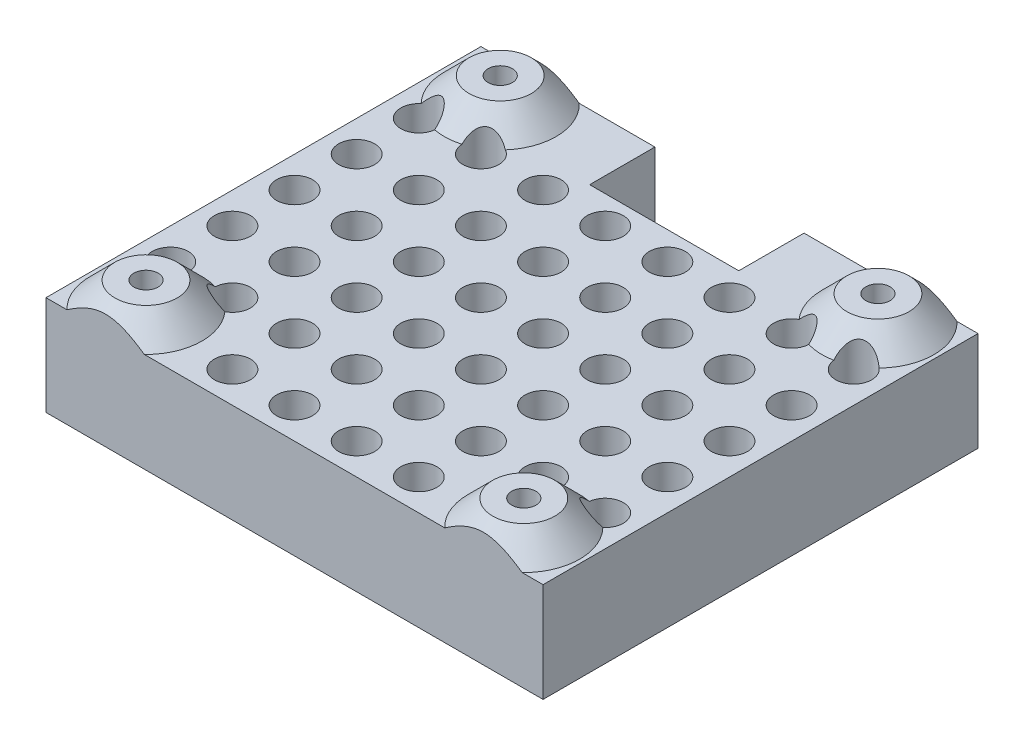
from build123d import *

# Parameters (mm, degrees)
SKETCH1_W                       = 40
SKETCH1_H                       = 35
BOSS_EXTRUDE1_DEPTH             = 8
SKETCH5_R                       = 1.45
CUT_EXTRUDE3_DEPTH              = 28.753378173
LPATTERN1_COUNT                 = 8
LPATTERN1_PITCH                 = 5
LPATTERN1_COUNT_DIR2            = 7
LPATTERN1_PITCH_DIR2            = 5
SKETCH2_R                       = 2.5
BOSS_EXTRUDE2_DEPTH             = 2
BOSS_EXTRUDE2_DIRECTION_2_REACH = 29.753
BOSS_EXTRUDE3_START             = -8
SKETCH6_R                       = 1.45
BOSS_EXTRUDE3_DEPTH             = 8
SKETCH3_R                       = 0.975
CUT_EXTRUDE1_DEPTH              = 29.394541729
SKETCH4_W                       = 12
SKETCH4_H                       = 5.25
CUT_EXTRUDE2_DEPTH              = 28.753378173
CHAMFER1_SIZE                   = 2


with BuildPart() as part:
    # Sketch1 → Boss-Extrude1 (new body)
    with BuildSketch(Plane(origin=(0, 0, 0), x_dir=(1, 0, 0), z_dir=(0, 1, 0))):
        Rectangle(SKETCH1_W, SKETCH1_H)
    extrude(amount=BOSS_EXTRUDE1_DEPTH)

    # Sketch5 → Cut-Extrude3 (cut, through all)
    with BuildSketch(Plane.XZ):
        with Locations(Location((-17.5, 15, 0), (0, 0, 270))):
            Circle(SKETCH5_R)
    cut_extrude3 = extrude(amount=-CUT_EXTRUDE3_DEPTH, mode=Mode.SUBTRACT)

    # LPattern1: Cut-Extrude3 8 × 7, 11 skipped
    with Locations(*[(i * LPATTERN1_PITCH, 0, -j * LPATTERN1_PITCH_DIR2) for i in range(LPATTERN1_COUNT) for j in range(LPATTERN1_COUNT_DIR2) if (i, j) not in ((0, 0), (0, 6), (1, 0), (1, 6), (2, 6), (3, 6), (4, 6), (5, 6), (6, 0), (6, 6), (7, 0), (7, 6))]):
        add(cut_extrude3, mode=Mode.SUBTRACT)

    # Sketch2 → Boss-Extrude2 (add)
    with BuildSketch(Plane(origin=(0, 8, 0), x_dir=(1, 0, 0), z_dir=(0, 1, 0))):
        with Locations(Location((-15.2, 14.25, 0), (0, 0, 270))):
            Circle(SKETCH2_R)
        with Locations(Location((15.2, 14.25, 0), (0, 0, 270))):
            Circle(SKETCH2_R)
        with Locations(Location((15.2, -14.25, 0), (0, 0, 270))):
            Circle(SKETCH2_R)
        with Locations(Location((-15.2, -14.25, 0), (0, 0, 270))):
            Circle(SKETCH2_R)
    extrude(amount=BOSS_EXTRUDE2_DEPTH)

    # Boss-Extrude2 direction 2: up to this face of the body (flat: up to its plane)
    boss_extrude2_direction_2_end = Plane(part.part.faces().sort_by_distance((0.104819126, 0, -0.449224824))[0])
    # Sketch2 → Boss-Extrude2 direction 2 (add, up to the picked face)
    with BuildSketch(Plane(origin=(0, 8, 0), x_dir=(1, 0, 0), z_dir=(0, 1, 0)), mode=Mode.PRIVATE) as boss_extrude2_direction_2_sk1:
        with Locations(Location((-15.2, 14.25, 0), (0, 0, 270))):
            Circle(SKETCH2_R)
    boss_extrude2_direction_2_tool1 = split(extrude(boss_extrude2_direction_2_sk1.sketch, amount=-BOSS_EXTRUDE2_DIRECTION_2_REACH, mode=Mode.PRIVATE), bisect_by=boss_extrude2_direction_2_end, keep=Keep.BOTH, mode=Mode.PRIVATE)
    # Sketch2 → Boss-Extrude2 direction 2 (add, up to the picked face)
    with BuildSketch(Plane(origin=(0, 8, 0), x_dir=(1, 0, 0), z_dir=(0, 1, 0)), mode=Mode.PRIVATE) as boss_extrude2_direction_2_sk2:
        with Locations(Location((15.2, 14.25, 0), (0, 0, 270))):
            Circle(SKETCH2_R)
    boss_extrude2_direction_2_tool2 = split(extrude(boss_extrude2_direction_2_sk2.sketch, amount=-BOSS_EXTRUDE2_DIRECTION_2_REACH, mode=Mode.PRIVATE), bisect_by=boss_extrude2_direction_2_end, keep=Keep.BOTH, mode=Mode.PRIVATE)
    # Sketch2 → Boss-Extrude2 direction 2 (add, up to the picked face)
    with BuildSketch(Plane(origin=(0, 8, 0), x_dir=(1, 0, 0), z_dir=(0, 1, 0)), mode=Mode.PRIVATE) as boss_extrude2_direction_2_sk3:
        with Locations(Location((15.2, -14.25, 0), (0, 0, 270))):
            Circle(SKETCH2_R)
    boss_extrude2_direction_2_tool3 = split(extrude(boss_extrude2_direction_2_sk3.sketch, amount=-BOSS_EXTRUDE2_DIRECTION_2_REACH, mode=Mode.PRIVATE), bisect_by=boss_extrude2_direction_2_end, keep=Keep.BOTH, mode=Mode.PRIVATE)
    # Sketch2 → Boss-Extrude2 direction 2 (add, up to the picked face)
    with BuildSketch(Plane(origin=(0, 8, 0), x_dir=(1, 0, 0), z_dir=(0, 1, 0)), mode=Mode.PRIVATE) as boss_extrude2_direction_2_sk4:
        with Locations(Location((-15.2, -14.25, 0), (0, 0, 270))):
            Circle(SKETCH2_R)
    boss_extrude2_direction_2_tool4 = split(extrude(boss_extrude2_direction_2_sk4.sketch, amount=-BOSS_EXTRUDE2_DIRECTION_2_REACH, mode=Mode.PRIVATE), bisect_by=boss_extrude2_direction_2_end, keep=Keep.BOTH, mode=Mode.PRIVATE)
    add(boss_extrude2_direction_2_tool1.solids().sort_by(Axis((-15.2, 8, -14.25), (0, -1, 0)))[0])
    add(boss_extrude2_direction_2_tool2.solids().sort_by(Axis((15.2, 8, -14.25), (0, -1, 0)))[0])
    add(boss_extrude2_direction_2_tool3.solids().sort_by(Axis((15.2, 8, 14.25), (0, -1, 0)))[0])
    add(boss_extrude2_direction_2_tool4.solids().sort_by(Axis((-15.2, 8, 14.25), (0, -1, 0)))[0])

    # Sketch6 → Boss-Extrude3 (add)
    with BuildSketch(Plane(origin=(0, 8, 0), x_dir=(1, 0, 0), z_dir=(0, 1, 0)).offset(BOSS_EXTRUDE3_START)):
        with Locations((-17.5, -15)):
            Circle(SKETCH6_R)
    extrude(amount=BOSS_EXTRUDE3_DEPTH)

    # Sketch3 → Cut-Extrude1 (cut, through all)
    with BuildSketch(Plane(origin=(0, 10, 0), x_dir=(1, 0, 0), z_dir=(0, 1, 0))):
        with Locations(Location((-15.2, 14.25, 0), (0, 0, 270))):
            Circle(SKETCH3_R)
        with Locations(Location((15.2, 14.25, 0), (0, 0, 270))):
            Circle(SKETCH3_R)
        with Locations(Location((-15.2, -14.25, 0), (0, 0, 270))):
            Circle(SKETCH3_R)
        with Locations(Location((15.2, -14.25, 0), (0, 0, 270))):
            Circle(SKETCH3_R)
    extrude(amount=-CUT_EXTRUDE1_DEPTH, mode=Mode.SUBTRACT)

    # Sketch4 → Cut-Extrude2 (cut, through all)
    with BuildSketch(Plane(origin=(0, 8, 0), x_dir=(1, 0, 0), z_dir=(0, 1, 0))):
        with Locations((0, 14.875)):
            Rectangle(SKETCH4_W, SKETCH4_H)
    extrude(amount=-CUT_EXTRUDE2_DEPTH, mode=Mode.SUBTRACT)

    # Chamfer1
    # the kernel refuses this chamfer: 2 mm, written as the material it adds along each edge
    with BuildSketch(Plane(origin=(-15.2, 8, -14.25), x_dir=(0, 0, 1), z_dir=(-1, 0, 0))) as chamfer1_piece_1_section:
        Polygon((2.5 + CHAMFER1_SIZE, 0), (2.5, CHAMFER1_SIZE), (2.5, 0), align=None)
    chamfer1_piece_1 = revolve(axis=Axis((-15.2, 8, -14.25), (0, 1, 0)), mode=Mode.PRIVATE)
    chamfer1_piece_1 = split(chamfer1_piece_1, bisect_by=Plane(origin=(-11.571473912, 8.26224679, -17.5), z_dir=(0, 0, 1)), keep=Keep.TOP, mode=Mode.PRIVATE)
    chamfer1_piece_1 = chamfer1_piece_1 - Plane(origin=(-12.5, 8.26224679, -10), x_dir=(0, 0, -1), z_dir=(0, -1, 0)) * Cylinder(1.45, 18, mode=Mode.PRIVATE)
    chamfer1_piece_1 = chamfer1_piece_1 - Plane(origin=(-17.5, 8.26224679, -10), x_dir=(0, 0, -1), z_dir=(0, -1, 0)) * Cylinder(1.45, 18, mode=Mode.PRIVATE)
    chamfer1_piece_1 = split(chamfer1_piece_1, bisect_by=Plane(origin=(-11.571473912, 10, -12.155069486), z_dir=(0, -1, 0)), keep=Keep.TOP, mode=Mode.PRIVATE)
    add(chamfer1_piece_1)
    with BuildSketch(Plane(origin=(15.2, 8, -14.25), x_dir=(0, 0, 1), z_dir=(-1, 0, 0))) as chamfer1_piece_2_section:
        Polygon((2.5 + CHAMFER1_SIZE, 0), (2.5, CHAMFER1_SIZE), (2.5, 0), align=None)
    chamfer1_piece_2 = revolve(axis=Axis((15.2, 8, -14.25), (0, 1, 0)), mode=Mode.PRIVATE)
    chamfer1_piece_2 = split(chamfer1_piece_2, bisect_by=Plane(origin=(18.828526094, 8.262246797, -17.5), z_dir=(0, 0, 1)), keep=Keep.TOP, mode=Mode.PRIVATE)
    chamfer1_piece_2 = chamfer1_piece_2 - Plane(origin=(17.5, 8.262246797, -10), x_dir=(0, 0, -1), z_dir=(0, -1, 0)) * Cylinder(1.45, 18, mode=Mode.PRIVATE)
    chamfer1_piece_2 = chamfer1_piece_2 - Plane(origin=(12.5, 8.262246797, -10), x_dir=(0, 0, -1), z_dir=(0, -1, 0)) * Cylinder(1.45, 18, mode=Mode.PRIVATE)
    chamfer1_piece_2 = split(chamfer1_piece_2, bisect_by=Plane(origin=(18.828526094, 10, -12.155069483), z_dir=(0, -1, 0)), keep=Keep.TOP, mode=Mode.PRIVATE)
    add(chamfer1_piece_2)
    with BuildSketch(Plane(origin=(15.2, 8, 14.25), x_dir=(0, 0, 1), z_dir=(-1, 0, 0))) as chamfer1_piece_3_section:
        Polygon((2.5 + CHAMFER1_SIZE, 0), (2.5, CHAMFER1_SIZE), (2.5, 0), align=None)
    chamfer1_piece_3 = revolve(axis=Axis((15.2, 8, 14.25), (0, 1, 0)), mode=Mode.PRIVATE)
    chamfer1_piece_3 = split(chamfer1_piece_3, bisect_by=Plane(origin=(15.2, 8.947769636, 17.5), z_dir=(0, 0, -1)), keep=Keep.TOP, mode=Mode.PRIVATE)
    chamfer1_piece_3 = chamfer1_piece_3 - Plane(origin=(17.5, 8.947769636, 10), x_dir=(0, 0, -1), z_dir=(0, -1, 0)) * Cylinder(1.45, 18, mode=Mode.PRIVATE)
    chamfer1_piece_3 = chamfer1_piece_3 - Plane(origin=(12.5, 8.947769636, 10), x_dir=(0, 0, -1), z_dir=(0, -1, 0)) * Cylinder(1.45, 18, mode=Mode.PRIVATE)
    chamfer1_piece_3 = split(chamfer1_piece_3, bisect_by=Plane(origin=(15.2, 10, 10.745661822), z_dir=(0, -1, 0)), keep=Keep.TOP, mode=Mode.PRIVATE)
    add(chamfer1_piece_3)
    with BuildSketch(Plane(origin=(-15.2, 8, 14.25), x_dir=(0, 0, 1), z_dir=(1, 0, 0))) as chamfer1_piece_4_section:
        Polygon((2.5 + CHAMFER1_SIZE, 0), (2.5, -CHAMFER1_SIZE), (2.5, 0), align=None)
    chamfer1_piece_4 = revolve(axis=Axis((-15.2, 8, 14.25), (0, -1, 0)), mode=Mode.PRIVATE)
    chamfer1_piece_4 = split(chamfer1_piece_4, bisect_by=Plane(origin=(-15.2, 8.947769652, 17.5), z_dir=(0, 0, -1)), keep=Keep.TOP, mode=Mode.PRIVATE)
    chamfer1_piece_4 = chamfer1_piece_4 - Plane(origin=(-12.5, 8.947769652, 10), x_dir=(0, 0, -1), z_dir=(0, -1, 0)) * Cylinder(1.45, 18, mode=Mode.PRIVATE)
    chamfer1_piece_4 = chamfer1_piece_4 - Plane(origin=(-17.5, 8.947769652, 10), x_dir=(0, 0, -1), z_dir=(0, -1, 0)) * Cylinder(1.45, 18, mode=Mode.PRIVATE)
    chamfer1_piece_4 = split(chamfer1_piece_4, bisect_by=Plane(origin=(-15.2, 10, 10.745661805), z_dir=(0, -1, 0)), keep=Keep.TOP, mode=Mode.PRIVATE)
    add(chamfer1_piece_4)


solid = part.part
